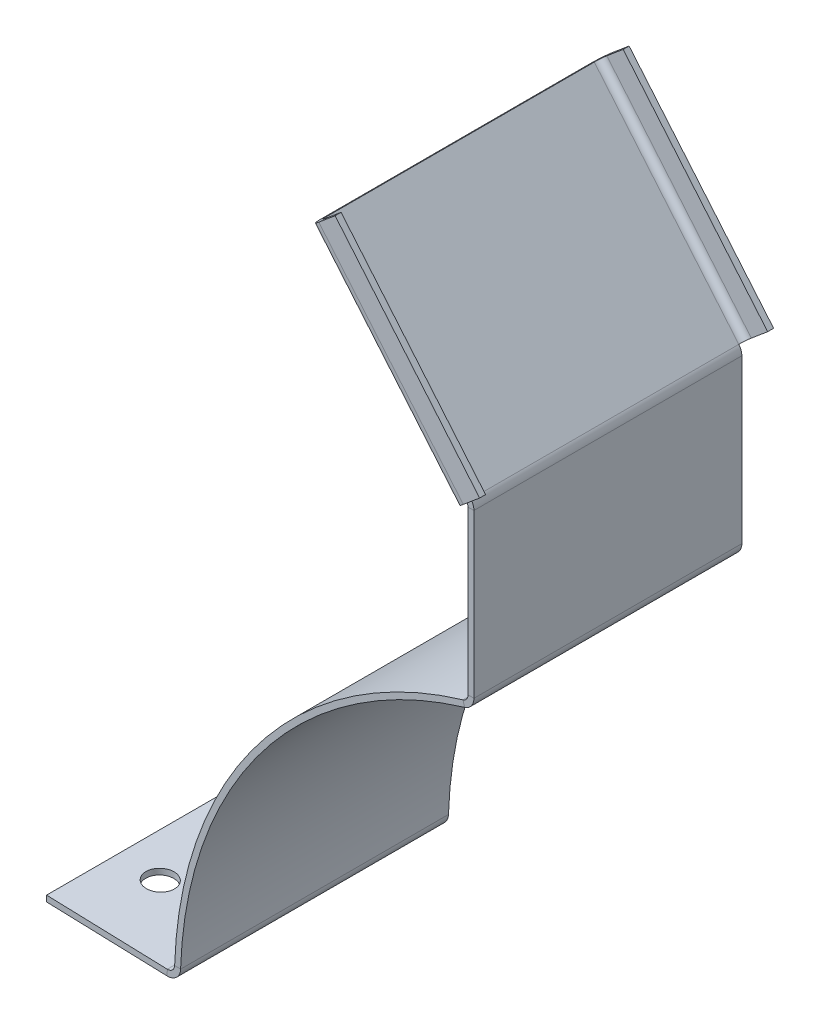
from build123d import *

# Parameters (mm, degrees)
BASE_FLANGE1_DEPTH           = 119.6975
EDGE_FLANGE1_DEPTH           = 119.6975
EDGE_FLANGE2_STRIP_CUT_DEPTH = 119.6975
EDGE_FLANGE2_DEPTH           = 119.6975
EDGE_FLANGE3_DEPTH           = 119.6975
SKETCH20_R                   = 6.35
CUT_EXTRUDE1_DEPTH           = 2.65684
EDGE_FLANGE4_DEPTH           = 100.444394506
EDGE_FLANGE5_DEPTH           = 100.444394506


# Sheet-metal steps are written as plain solids
with BuildPart() as part:
    # Sketch1 → Base-Flange1 (new body)
    with BuildSketch(Plane.XY):
        with BuildLine():
            ThreePointArc((-50.8, 170.388379885), (-140.856418383, 108.500273734), (-177.710803869, 5.63118))
            Line((-177.710803869, 5.63118), (-180.366311024, 5.715325918))
            ThreePointArc((-180.366311024, 5.715325918), (-142.961215721, 110.121577824), (-51.559097143, 172.934469105))
            Line((-51.559097143, 172.934469105), (-50.8, 170.388379885))
        make_face()
    extrude(amount=BASE_FLANGE1_DEPTH)

    # Edge-Flange1 section (across the edge) → Edge-Flange1 (add)
    with BuildSketch(Plane(origin=(-49.291175996, 173.610632552, 119.6975), x_dir=(-0.9999999996342678, -2.7045604981568168e-05, 0), z_dir=(0, 0, -1))):
        with BuildLine():
            Line((-2.65684, 2.366572064), (-2.65684, 76.2))
            Line((-2.65684, 76.2), (0, 76.2))
            Line((0, 76.2), (0, 2.366572064))
            ThreePointArc((0, 2.366572064), (0.62936233, 0.469112223), (2.267939433, -0.676102109))
            Line((2.267939433, -0.676102109), (1.508911151, -3.222211858))
            ThreePointArc((1.508911151, -3.222211858), (-1.500827273, -1.118682173), (-2.65684, 2.366572064))
        make_face()
    extrude(amount=EDGE_FLANGE1_DEPTH)

    # Edge-Flange2 strip (across the edge) → Edge-Flange2 strip cut (cut)
    with BuildSketch(Plane(origin=(-49.293236871, 249.810632524, 119.6975), x_dir=(-0.7660270582590358, -0.6428083275868537, 0), z_dir=(0, 0, -1))):
        Polygon((-12.205285278, 10.412383287), (-1.292448625, -2.593029), (0.742808893, -0.885245167), (-10.17002776, 12.12016712), align=None)
    extrude(amount=EDGE_FLANGE2_STRIP_CUT_DEPTH, mode=Mode.SUBTRACT)

    # Edge-Flange2 section (across the edge) → Edge-Flange2 (add)
    with BuildSketch(Plane(origin=(-49.293236871, 249.810632524, 119.6975), x_dir=(-0.7660270582590358, -0.6428083275868537, 0), z_dir=(0, 0, -1))):
        with BuildLine():
            Line((-2.65684, 1.155605494), (-2.65684, 101.6))
            Line((-2.65684, 101.6), (0, 101.6))
            Line((0, 101.6), (0, 1.155605494))
            ThreePointArc((0, 1.155605494), (0.191475929, 0.069691539), (0.742808893, -0.885245167))
            Line((0.742808893, -0.885245167), (-1.292448625, -2.593029))
            ThreePointArc((-1.292448625, -2.593029), (-2.305137014, -0.839001259), (-2.65684, 1.155605494))
        make_face()
    extrude(amount=EDGE_FLANGE2_DEPTH)

    # Edge-Flange3 section (across the edge) → Edge-Flange3 (add)
    with BuildSketch(Plane(origin=(-180.46686781, 2.541918706, 0), x_dir=(0.0316714285714251, 0.9994983344719717, 0), z_dir=(0, 0, 1))):
        with BuildLine():
            Line((-2.65684, 3.175), (-2.65684, 57.15))
            Line((-2.65684, 57.15), (0, 57.15))
            Line((0, 57.15), (0, 3.175))
            ThreePointArc((0, 3.175), (0.92993597, 0.92993597), (3.175, 0))
            Line((3.175, 0), (3.175, -2.65684))
            ThreePointArc((3.175, -2.65684), (-0.948733611, -0.948733611), (-2.65684, 3.175))
        make_face()
    extrude(amount=EDGE_FLANGE3_DEPTH)

    # Sketch20 → Cut-Extrude1 (cut)
    with BuildSketch(Plane(origin=(-0.100556786, -3.173407212, 0), x_dir=(0.9994983344719716, -0.03167142857142512, 0), z_dir=(0.03167142857142512, 0.9994983344719717, 0))):
        with Locations(Location((-218.55684, -31.75, 0), (0, 0, 180))):
            Circle(SKETCH20_R)
        with Locations(Location((-218.55684, -87.9475, 0), (0, 0, 180))):
            Circle(SKETCH20_R)
    extrude(amount=-CUT_EXTRUDE1_DEPTH, mode=Mode.SUBTRACT)

    # Edge-Flange4 section (across the edge) → Edge-Flange4 (add)
    with BuildSketch(Plane(origin=(-112.567351624, 329.34682052, 122.8725), x_dir=(0, 0, -1), z_dir=(0.6428083275868537, -0.7660270582590358, 0))):
        with BuildLine():
            Line((-2.65684, 3.175), (-2.65684, 12.7))
            Line((-2.65684, 12.7), (0, 12.7))
            Line((0, 12.7), (0, 3.175))
            ThreePointArc((0, 3.175), (0.92993597, 0.92993597), (3.175, 0))
            Line((3.175, 0), (3.175, -2.65684))
            ThreePointArc((3.175, -2.65684), (-0.948733611, -0.948733611), (-2.65684, 3.175))
        make_face()
    extrude(amount=EDGE_FLANGE4_DEPTH)

    # Edge-Flange5 section (across the edge) → Edge-Flange5 (add)
    with BuildSketch(Plane(origin=(-48.000858376, 252.403696478, -3.175), x_dir=(0, 0, 1), z_dir=(-0.642808327586854, 0.7660270582590356, 0))):
        with BuildLine():
            Line((-2.65684, 3.175), (-2.65684, 12.7))
            Line((-2.65684, 12.7), (0, 12.7))
            Line((0, 12.7), (0, 3.175))
            ThreePointArc((0, 3.175), (0.92993597, 0.92993597), (3.175, 0))
            Line((3.175, 0), (3.175, -2.65684))
            ThreePointArc((3.175, -2.65684), (-0.948733611, -0.948733611), (-2.65684, 3.175))
        make_face()
    extrude(amount=EDGE_FLANGE5_DEPTH)


solid = part.part
